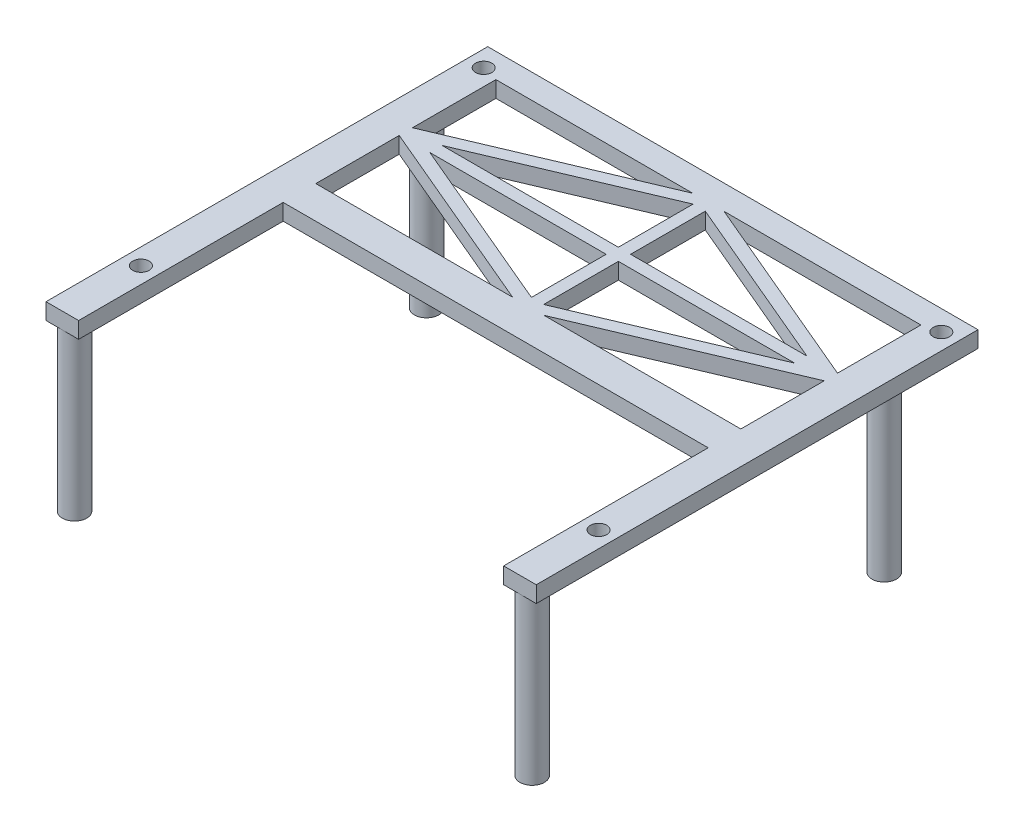
from build123d import *

# Parameters (mm, degrees)
SKETCH_1_R          = 1.5
EXTRUDE_1_DEPTH     = 20
EXTRUDE_1_2_DEPTH   = 20
EXTRUDE_1_3_DEPTH   = 20
EXTRUDE_1_4_DEPTH   = 20
EXTRUDE_2_DEPTH     = 2
SKETCH_4_R          = 1
CUT_EXTRUDE_1_DEPTH = 2
SKETCH_5_W          = 52.13
SKETCH_5_H          = 3
EXTRUDE_3_DEPTH     = 2
EXTRUDE_START       = -2
EXTRUDE_3_2_DEPTH   = 2


# Read off the part's stored shape, not the designer's step: 拉伸-薄壁3
with BuildPart() as part:
    # 草图1 → 凸台-拉伸1 (new body)
    with BuildSketch(Plane(origin=(0, 0, 0), x_dir=(1, 0, 0), z_dir=(0, 1, 0))):
        with Locations(Location((0, 0, 0), (0, 0, 270))):
            Circle(SKETCH_1_R)
    extrude(amount=EXTRUDE_1_DEPTH)



with BuildPart() as body_2:
    # 草图1 → Extrude 1 2 (new body)
    with BuildSketch(Plane(origin=(0, 0, 0), x_dir=(1, 0, 0), z_dir=(0, 1, 0))):
        with Locations(Location((0, 43.18, 0), (0, 0, 270))):
            Circle(SKETCH_1_R)
    extrude(amount=EXTRUDE_1_2_DEPTH)


with BuildPart() as body_3:
    # 草图1 → Extrude 1 3 (new body)
    with BuildSketch(Plane(origin=(0, 0, 0), x_dir=(1, 0, 0), z_dir=(0, 1, 0))):
        with Locations(Location((56.13, 43.18, 0), (0, 0, 270))):
            Circle(SKETCH_1_R)
    extrude(amount=EXTRUDE_1_3_DEPTH)


with BuildPart() as body_4:
    # 草图1 → Extrude 1 4 (new body)
    with BuildSketch(Plane(origin=(0, 0, 0), x_dir=(1, 0, 0), z_dir=(0, 1, 0))):
        with Locations(Location((56.13, 0, 0), (0, 0, 270))):
            Circle(SKETCH_1_R)
    extrude(amount=EXTRUDE_1_4_DEPTH)


with BuildPart() as part_1:
    add(part.part)

    add(body_2.part)  # 凸台-拉伸2 merges body 2
    # 草图2 → 凸台-拉伸2 (add)
    with BuildSketch(Plane(origin=(0, 20, 0), x_dir=(1, 0, 0), z_dir=(0, 1, 0))):
        Polygon((-2, 52.68), (-2, -1.5), (2, -1.5), (2, 23.59), (54.13, 23.59), (54.13, -1.5), (58.13, -1.5), (58.13, 52.68), (54.13, 52.68), (54.13, 27.59), (2, 27.59), (2, 52.68), align=None)
    extrude(amount=EXTRUDE_2_DEPTH)

    # 草图4 → 切除-拉伸1 (cut)
    with BuildSketch(Plane(origin=(0, 22, 0), x_dir=(1, 0, 0), z_dir=(0, 1, 0))):
        with Locations(Location((0, 50.18, 0), (0, 0, 270))):
            Circle(SKETCH_4_R)
        with Locations(Location((0, 8.143, 0), (0, 0, 270))):
            Circle(SKETCH_4_R)
        with Locations(Location((56.13, 8.143, 0), (0, 0, 270))):
            Circle(SKETCH_4_R)
        with Locations(Location((56.13, 50.18, 0), (0, 0, 270))):
            Circle(SKETCH_4_R)
    extrude(amount=-CUT_EXTRUDE_1_DEPTH, mode=Mode.SUBTRACT)

    # 草图5 → Extrude 3 (add)
    with BuildSketch(Plane.XZ.offset(-20)):
        with Locations((28.065, -51.18)):
            Rectangle(SKETCH_5_W, SKETCH_5_H)
    extrude(amount=-EXTRUDE_3_DEPTH)

    # Extrude 3 2 outline → Extrude 3 2 (add)
    with BuildSketch(Plane.XZ.offset(-20).offset(EXTRUDE_START)):
        Polygon((26.142732706, -27.59), (2, -37.820442461), (2, -39.449557539), (26.142732706, -49.68), (29.987267294, -49.68), (54.13, -39.449557539), (54.13, -37.820442461), (29.987267294, -27.59), align=None)
        Polygon((27.315, -48.547631219), (5.692185809, -39.385), (27.315, -39.385), align=None, mode=Mode.SUBTRACT)
        Polygon((28.815, -39.385), (50.437814191, -39.385), (28.815, -48.547631219), align=None, mode=Mode.SUBTRACT)
        Polygon((27.315, -37.885), (5.692185809, -37.885), (27.315, -28.722368781), align=None, mode=Mode.SUBTRACT)
        Polygon((28.815, -37.885), (28.815, -28.722368781), (50.437814191, -37.885), align=None, mode=Mode.SUBTRACT)
    extrude(amount=EXTRUDE_3_2_DEPTH)


solid = Compound([body_3.part, body_4.part, part_1.part])
